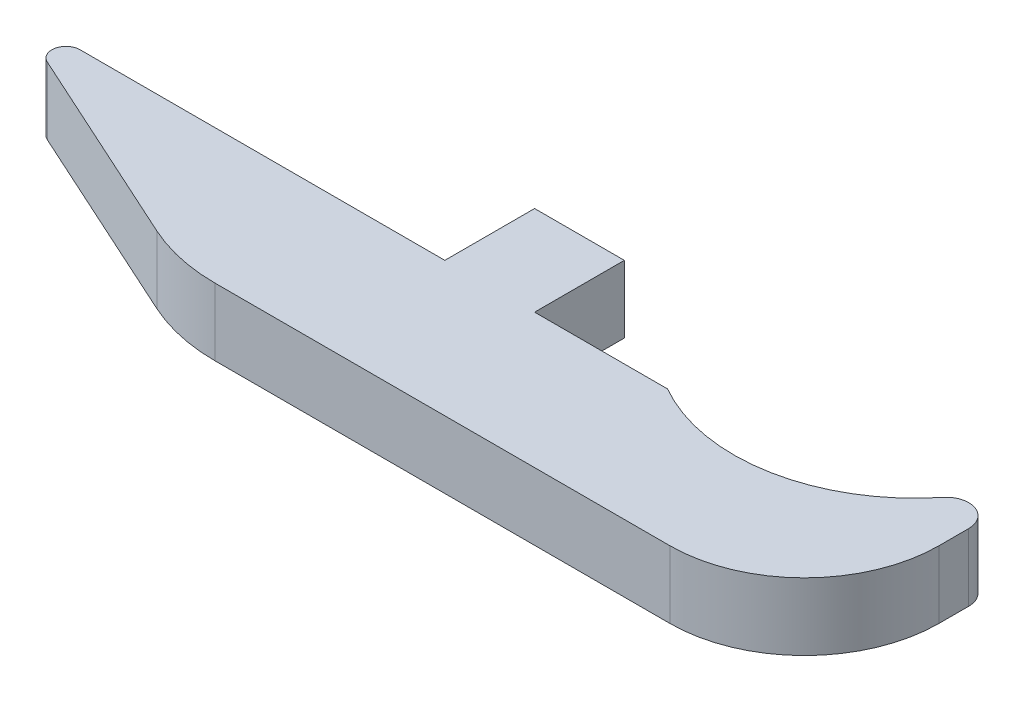
from build123d import *

# Parameters (mm, degrees)
BOSS_EXTRUDE1_DEPTH = 4.7625
FILLET1_R           = 9.525
FILLET2_R           = 1.5875
FILLET4_R           = 12.7
BOSS_EXTRUDE2_DEPTH = 4.7625
FILLET5_R           = 1


with BuildPart() as part:
    # Sketch1 → Boss-Extrude1 (new body)
    with BuildSketch(Plane(origin=(0, 0, 0), x_dir=(1, 0, 0), z_dir=(0, 1, 0))):
        with BuildLine():
            ThreePointArc((68.55459999999994, 11.1252), (62.15558311010997, 0.02506657124609291), (49.34309892630538, 3.1797e-13))
            Line((49.3430989263053, 3.98e-15), (3.17499999999972, 1.88e-15))
            Line((3.174999999999723, -3.02e-15), (24.10459999999994, -9.525))
            Line((24.10459999999994, -9.525), (68.55459999999994, -9.525))
            Line((68.55459999999994, -9.525), (68.55459999999994, 11.125200000000005))
        make_face()
    extrude(amount=BOSS_EXTRUDE1_DEPTH)

    # Fillet1
    fillet1_edges = [part.edges().sort_by_distance(p)[0] for p in [
        (68.55459999999994, 2.38125, 9.525),
    ]]
    fillet(fillet1_edges, radius=FILLET1_R)

    # Fillet2
    fillet2_edges = [part.edges().sort_by_distance(p)[0] for p in [
        (68.55459999999994, 2.38125, -11.125200000000003),
    ]]
    fillet(fillet2_edges, radius=FILLET2_R)

    # Fillet4
    fillet4_edges = [part.edges().sort_by_distance(p)[0] for p in [
        (24.10459999999994, 2.38125, 9.525),
    ]]
    fillet(fillet4_edges, radius=FILLET4_R)

    # Sketch2 → Boss-Extrude2 (add)
    with BuildSketch(Plane.XZ):
        Polygon((33.58949999999994, -6.349999999999999), (39.93949999999993, -6.349999999999998), (39.93949999999993, 5.33e-15), (33.58949999999994, 4.43e-15), align=None)
    extrude(amount=-BOSS_EXTRUDE2_DEPTH)

    # Fillet5
    fillet5_edges = [part.edges().sort_by_distance(p)[0] for p in [
        (3.174999999999722, 2.38125, 5.7e-16),
    ]]
    fillet(fillet5_edges, radius=FILLET5_R)


solid = part.part
